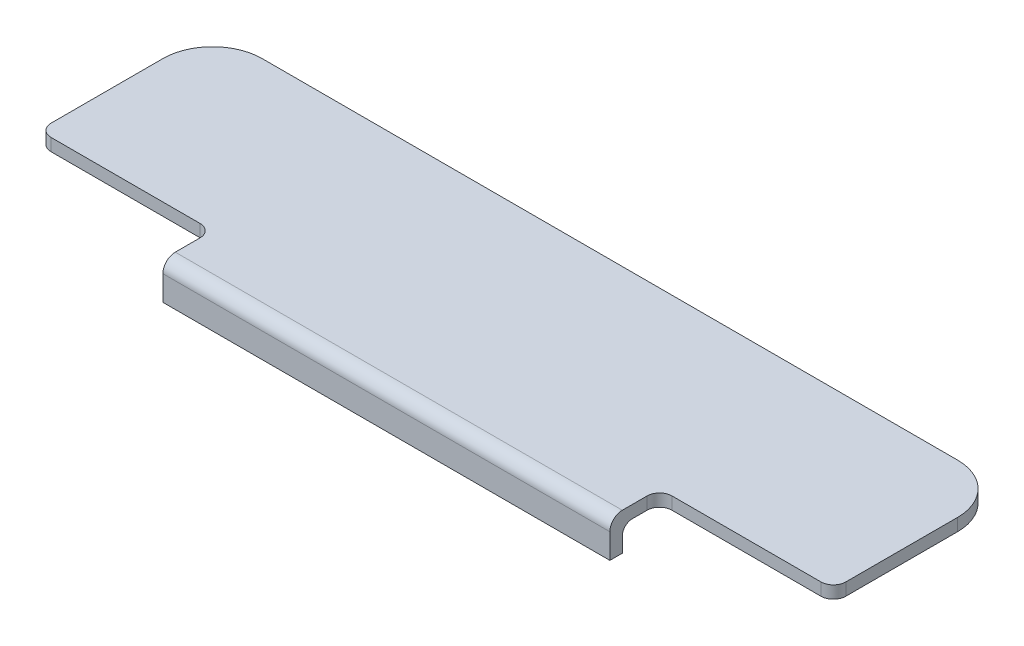
from build123d import *

# Parameters (mm, degrees)
SKETCH_1_W          = 320
SKETCH_1_H          = 90
EXTRUDE_1_DEPTH     = 5
SKETCH_2_W          = 320
SKETCH_2_H          = 5
EXTRUDE_2_DEPTH     = 10
FILLET_3_R          = 5
FILLET_4_R          = 4
SKETCH_3_W          = 70
SKETCH_3_H          = 20
CUT_EXTRUDE_1_DEPTH = 33
FILLET_5_R          = 5
FILLET_6_R          = 20


with BuildPart() as part:
    # 草图1 → 凸台-拉伸1 (new body)
    with BuildSketch(Plane(origin=(0, 0, 0), x_dir=(1, 0, 0), z_dir=(0, 1, 0))):
        Rectangle(SKETCH_1_W, SKETCH_1_H)
    extrude(amount=EXTRUDE_1_DEPTH)

    # 草图2 → 凸台-拉伸2 (add)
    with BuildSketch(Plane.XZ):
        with Locations((0, 42.5)):
            Rectangle(SKETCH_2_W, SKETCH_2_H)
    extrude(amount=EXTRUDE_2_DEPTH)

    # 圆角3
    fillet_3_edges = [part.edges().sort_by_distance(p)[0] for p in [
        (0, 5, 45),
    ]]
    fillet(fillet_3_edges, radius=FILLET_3_R)

    # 圆角4
    fillet_4_edges = [part.edges().sort_by_distance(p)[0] for p in [
        (0, 0, 40),
    ]]
    fillet(fillet_4_edges, radius=FILLET_4_R)

    # 草图3 → 切除-拉伸1 (cut)
    with BuildSketch(Plane(origin=(0, 5, 0), x_dir=(1, 0, 0), z_dir=(0, 1, 0))):
        with Locations((-125, -35)):
            Rectangle(SKETCH_3_W, SKETCH_3_H)
        with Locations((125, -35)):
            Rectangle(SKETCH_3_W, SKETCH_3_H)
    extrude(amount=-CUT_EXTRUDE_1_DEPTH, mode=Mode.SUBTRACT)

    # 圆角5
    fillet_5_edges = [part.edges().sort_by_distance(p)[0] for p in [
        (160, 2.5, 25),
        (90, 2.5, 25),
        (-160, 2.5, 25),
        (-90, 2.5, 25),
    ]]
    fillet(fillet_5_edges, radius=FILLET_5_R)

    # 圆角6
    fillet_6_edges = [part.edges().sort_by_distance(p)[0] for p in [
        (-160, 2.5, -45),
        (160, 2.5, -45),
    ]]
    fillet(fillet_6_edges, radius=FILLET_6_R)


solid = part.part
